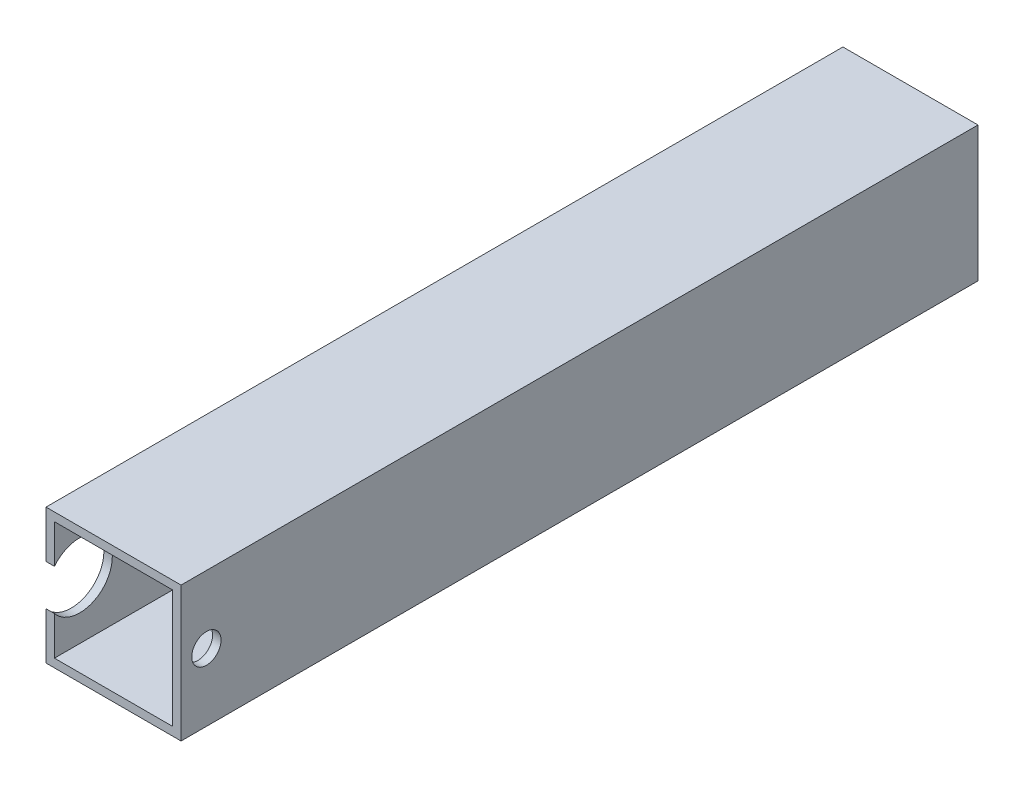
from build123d import *

# Parameters (mm, degrees)
SKETCH1_W                                    = 25.4
SKETCH1_H                                    = 25.4
BOSS_EXTRUDE1_DEPTH                          = 74.93
SHELL1_T                                     = -1.5875
CBORE_FOR_M5_HEX_HEAD_CAP_SCREW1_D           = 5.5
CBORE_FOR_M5_HEX_HEAD_CAP_SCREW1_CBORE_D     = 12.24
CBORE_FOR_M5_HEX_HEAD_CAP_SCREW1_CBORE_DEPTH = 3.65


with BuildPart() as part:
    # Sketch1 → Boss-Extrude1 (new, symmetric)
    with BuildSketch(Plane.XY):
        Rectangle(SKETCH1_W, SKETCH1_H)
    extrude(amount=BOSS_EXTRUDE1_DEPTH, both=True)

    # Shell1
    shell1_openings = [part.faces().sort_by_distance(p)[0] for p in [
        (0, 0, -74.93),
        (0, 0, 74.93),
    ]]
    offset(amount=SHELL1_T, openings=shell1_openings, kind=Kind.INTERSECTION)

    # CBORE for M5 Hex Head Cap Screw1 (through all)
    with Locations(Plane.ZY.offset(12.7)):
        with Locations((70.1675, 0)):
            CounterBoreHole(CBORE_FOR_M5_HEX_HEAD_CAP_SCREW1_D / 2, CBORE_FOR_M5_HEX_HEAD_CAP_SCREW1_CBORE_D / 2, CBORE_FOR_M5_HEX_HEAD_CAP_SCREW1_CBORE_DEPTH)


solid = part.part
